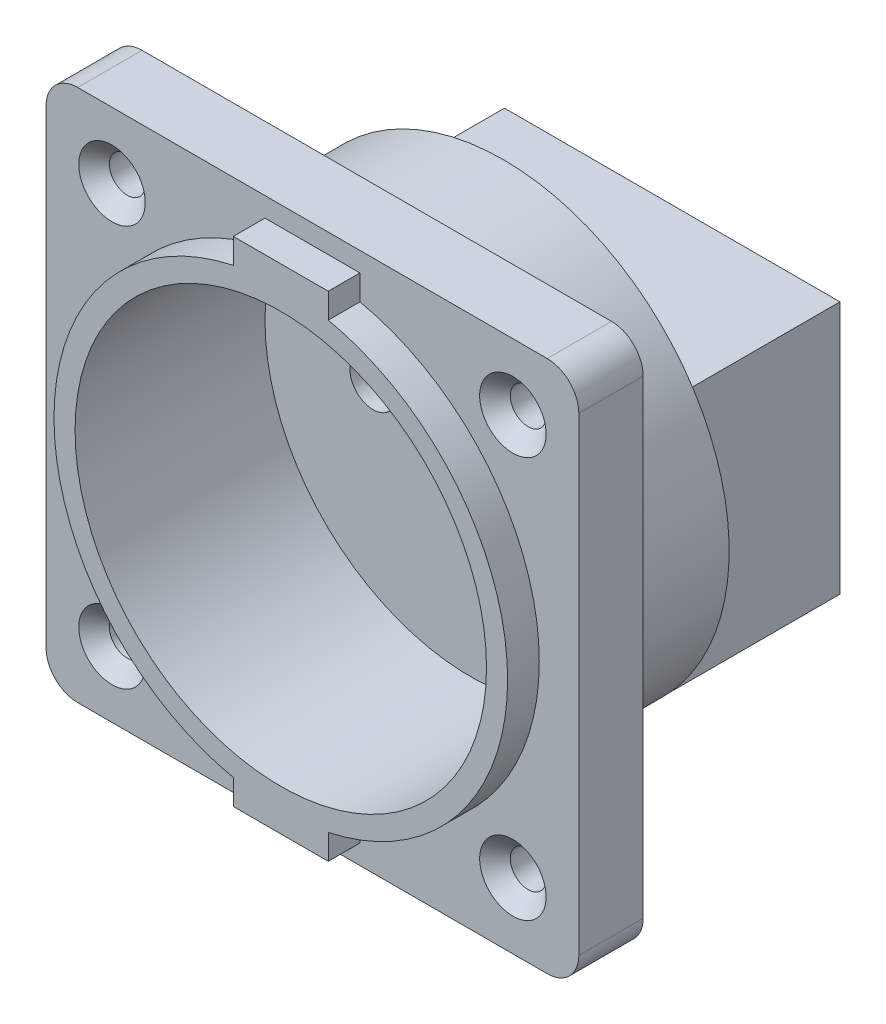
from build123d import *

# Parameters (mm, degrees)
SKIZZE1_W                                            = 50.5
SKIZZE1_H                                            = 50.5
AUFSATZ_LINEAR_AUSTRAGEN1_DEPTH                      = 6.1
AUFSATZ_LINEAR_AUSTRAGEN2_DEPTH                      = 3
SKIZZE3_R                                            = 21.4
AUFSATZ_LINEAR_AUSTRAGEN3_DEPTH                      = 12
SKIZZE4_W                                            = 31.8
SKIZZE4_H                                            = 24
AUFSATZ_LINEAR_AUSTRAGEN4_DEPTH                      = 16
FORMSENKUNG_F_R_M3_LINSENSENKSCHRAUBE_MI_D           = 3.4
FORMSENKUNG_F_R_M3_LINSENSENKSCHRAUBE_MI_CSINK_D     = 6.3
FORMSENKUNG_F_R_M3_LINSENSENKSCHRAUBE_MI_CSINK_ANGLE = 90
VERRUNDUNG1_R                                        = 3
SKIZZE7_R                                            = 19.5
SCHNITT_LINEAR_AUSTRAGEN1_DEPTH                      = 18
F_4_4_4_4_DURCHMESSER_BOHRUNG1_D                     = 4.4


with BuildPart() as part:
    # Skizze1 → Aufsatz-Linear austragen1 (new body)
    with BuildSketch(Plane.XY):
        Rectangle(SKIZZE1_W, SKIZZE1_H)
    extrude(amount=AUFSATZ_LINEAR_AUSTRAGEN1_DEPTH)

    # Skizze2 → Aufsatz-Linear austragen2 (add)
    with BuildSketch(Plane.XY.offset(6.1)):
        with BuildLine():
            Line((4.5, 23.4), (-4.5, 23.4))
            Line((-4.5, 23.4), (-4.5, 21.023796042))
            ThreePointArc((-4.5, 21.023796042), (-21.5, 0), (-4.5, -21.023796042))
            Line((-4.5, -21.023796042), (-4.5, -23.4))
            Line((-4.5, -23.4), (4.5, -23.4))
            Line((4.5, -23.4), (4.5, -21.023796042))
            ThreePointArc((4.5, -21.023796042), (21.5, 0), (4.5, 21.023796042))
            Line((4.5, 21.023796042), (4.5, 23.4))
        make_face()
    extrude(amount=AUFSATZ_LINEAR_AUSTRAGEN2_DEPTH)

    # Skizze3 → Aufsatz-Linear austragen3 (add)
    with BuildSketch(Plane(origin=(0, 0, 0), x_dir=(-1, 0, 0), z_dir=(0, 0, -1))):
        Circle(SKIZZE3_R)
    extrude(amount=AUFSATZ_LINEAR_AUSTRAGEN3_DEPTH)

    # Skizze4 → Aufsatz-Linear austragen4 (add)
    with BuildSketch(Plane(origin=(0, 0, -12), x_dir=(-1, 0, 0), z_dir=(0, 0, -1))):
        with Locations((0, -2.323058333)):
            Rectangle(SKIZZE4_W, SKIZZE4_H)
    extrude(amount=AUFSATZ_LINEAR_AUSTRAGEN4_DEPTH)

    # Formsenkung für M3 Linsensenkschraube mit Schlitz1 (through all)
    with Locations(Plane.XY.offset(6.1)):
        with Locations((-19, 19), (19, 19), (19, -19), (-19, -19)):
            CounterSinkHole(FORMSENKUNG_F_R_M3_LINSENSENKSCHRAUBE_MI_D / 2, FORMSENKUNG_F_R_M3_LINSENSENKSCHRAUBE_MI_CSINK_D / 2, counter_sink_angle=FORMSENKUNG_F_R_M3_LINSENSENKSCHRAUBE_MI_CSINK_ANGLE)

    # Verrundung1
    verrundung1_edges = [part.edges().sort_by_distance(p)[0] for p in [
        (25.25, -25.25, 3.05),
        (25.25, 25.25, 3.05),
        (-25.25, -25.25, 3.05),
        (-25.25, 25.25, 3.05),
    ]]
    fillet(verrundung1_edges, radius=VERRUNDUNG1_R)

    # Skizze7 → Schnitt-Linear austragen1 (cut)
    with BuildSketch(Plane.XY.offset(9.1)):
        Circle(SKIZZE7_R)
    extrude(amount=-SCHNITT_LINEAR_AUSTRAGEN1_DEPTH, mode=Mode.SUBTRACT)

    # Ø4.4 (4.4) Durchmesser Bohrung1 (through all)
    with Locations(Plane.XY.offset(-8.9)):
        with Locations((-9.25, 0), (9.25, 0)):
            Hole(F_4_4_4_4_DURCHMESSER_BOHRUNG1_D / 2)


solid = part.part
